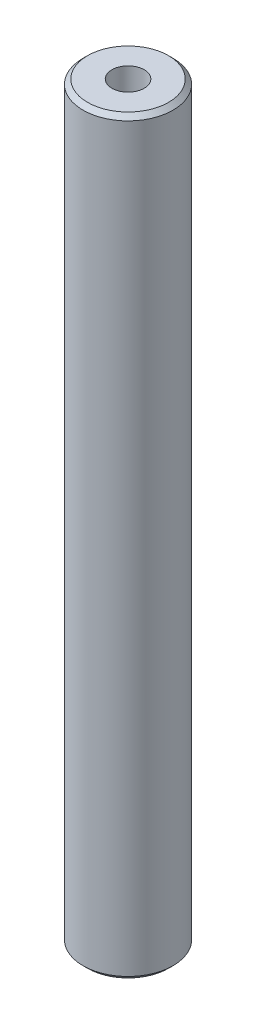
from build123d import *

# Parameters (mm, degrees)
SKETCH1_R           = 12.5
BOSS_EXTRUDE1_DEPTH = 208.357307326
SKETCH2_R           = 4.479730658
CUT_EXTRUDE1_DEPTH  = 210.105876331
CHAMFER1_SIZE       = 1.251864249


with BuildPart() as part:
    # Sketch1 → Boss-Extrude1 (new body)
    with BuildSketch(Plane(origin=(0, 0, 0), x_dir=(1, 0, 0), z_dir=(0, 1, 0))):
        Circle(SKETCH1_R)
    extrude(amount=BOSS_EXTRUDE1_DEPTH)

    # Sketch2 → Cut-Extrude1 (cut, through all)
    with BuildSketch(Plane(origin=(0, 0, 0), x_dir=(1, 0, 0), z_dir=(0, 1, 0))):
        Circle(SKETCH2_R)
    extrude(amount=CUT_EXTRUDE1_DEPTH, mode=Mode.SUBTRACT)

    # Chamfer1
    chamfer1_edges = [part.edges().sort_by_distance(p)[0] for p in [
        (-12.5, 208.357307326, 0),
        (-12.5, 0, 0),
    ]]
    chamfer(chamfer1_edges, length=CHAMFER1_SIZE)


solid = part.part
